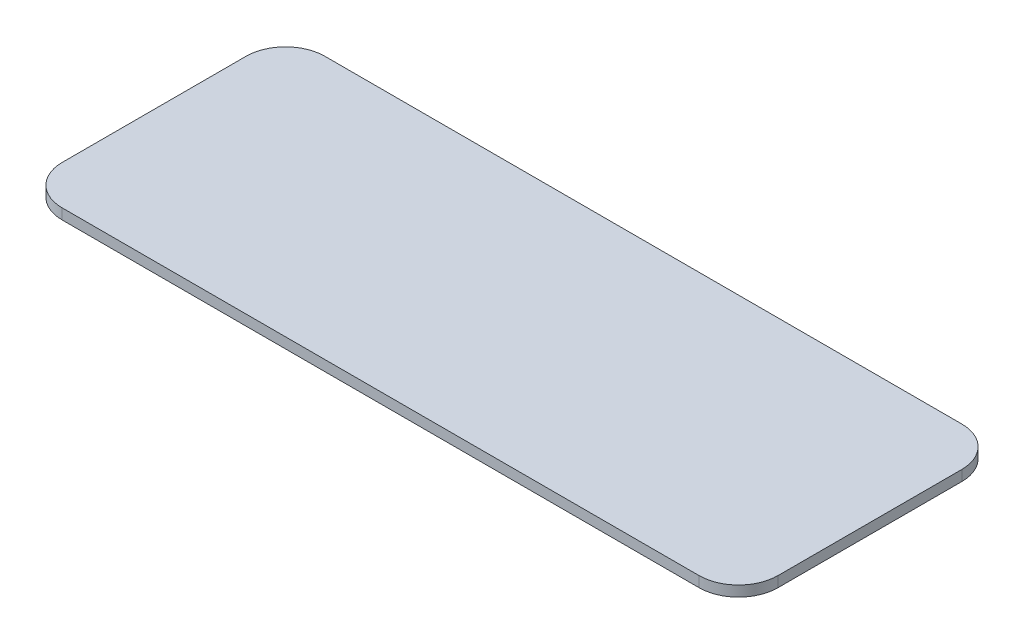
from build123d import *

# Parameters (mm, degrees)
AUFSATZ_LINEAR_AUSTRAGEN1_DEPTH = 1.6


with BuildPart() as part:
    # Skizze1 → Aufsatz-Linear austragen1 (new body)
    with BuildSketch(Plane(origin=(0, 0, 0), x_dir=(1, 0, 0), z_dir=(0, 1, 0))):
        with BuildLine():
            Line((-48.5, 20), (48.5, 20))
            ThreePointArc((48.5, 20), (52.742640687, 18.242640687), (54.5, 14))
            Line((54.5, 14), (54.5, -14))
            ThreePointArc((54.5, -14), (52.742640687, -18.242640687), (48.5, -20))
            Line((48.5, -20), (-48.5, -20))
            ThreePointArc((-48.5, -20), (-52.742640687, -18.242640687), (-54.5, -14))
            Line((-54.5, -14), (-54.5, 14))
            ThreePointArc((-54.5, 14), (-52.742640687, 18.242640687), (-48.5, 20))
        make_face()
    extrude(amount=AUFSATZ_LINEAR_AUSTRAGEN1_DEPTH)


solid = part.part
